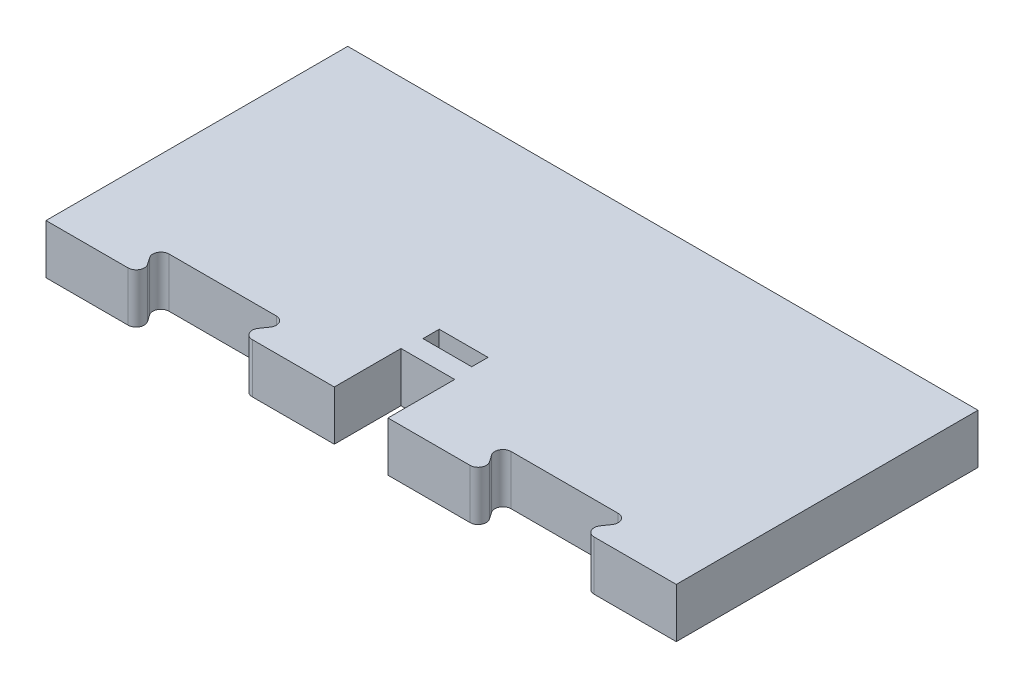
from build123d import *

# Parameters (mm, degrees)
SKETCH1_W           = 38.75
SKETCH1_H           = 8.3
BOSS_EXTRUDE1_DEPTH = 3.05
SKETCH3_W           = 3
SKETCH3_H           = 1
SKETCH3_W_2         = 3.3
SKETCH3_H_2         = 4.1
CUT_EXTRUDE2_DEPTH  = 40.746131887
CUT_EXTRUDE1_DEPTH  = 40.746131887
FILLET1_R           = 0.5
SKETCH4_W           = 38.75
SKETCH4_H           = 3.05
BOSS_EXTRUDE2_DEPTH = 10.25


with BuildPart() as part:
    # Sketch1 → Boss-Extrude1 (new body)
    with BuildSketch(Plane(origin=(0, 0, 0), x_dir=(1, 0, 0), z_dir=(0, 1, 0))):
        with Locations((19.375, 4.15)):
            Rectangle(SKETCH1_W, SKETCH1_H)
    extrude(amount=BOSS_EXTRUDE1_DEPTH)

    # Sketch3 → Cut-Extrude2 (cut, through all)
    with BuildSketch(Plane(origin=(0, 3.05, 0), x_dir=(1, 0, 0), z_dir=(0, 1, 0))):
        with Locations((19.375, 5.8)):
            Rectangle(SKETCH3_W, SKETCH3_H)
        with Locations((19.375, 2.05)):
            Rectangle(SKETCH3_W_2, SKETCH3_H_2)
    extrude(amount=-CUT_EXTRUDE2_DEPTH, mode=Mode.SUBTRACT)

    # Sketch2 → Cut-Extrude1 (cut, through all)
    with BuildSketch(Plane(origin=(0, 3.05, 0), x_dir=(1, 0, 0), z_dir=(0, 1, 0))):
        Polygon((4.6125, 2), (6, 0), (11.725, 0), (13.1125, 2), align=None)
        Polygon((25.6375, 2), (27.025, 0), (32.75, 0), (34.1375, 2), align=None)
    extrude(amount=-CUT_EXTRUDE1_DEPTH, mode=Mode.SUBTRACT)

    # Fillet1
    fillet1_edges = [part.edges().sort_by_distance(p)[0] for p in [
        (32.75, 1.525, 0),
        (27.025, 1.525, 0),
        (11.725, 1.525, 0),
        (6, 1.525, 0),
        (25.6375, 1.525, -2),
        (34.1375, 1.525, -2),
        (13.1125, 1.525, -2),
        (4.6125, 1.525, -2),
    ]]
    fillet(fillet1_edges, radius=FILLET1_R)

    # Sketch4 → Boss-Extrude2 (add)
    with BuildSketch(Plane(origin=(0, 0, -8.3), x_dir=(-1, 0, 0), z_dir=(0, 0, -1))):
        with Locations((-19.375, 1.525)):
            Rectangle(SKETCH4_W, SKETCH4_H)
    extrude(amount=BOSS_EXTRUDE2_DEPTH)


solid = part.part
